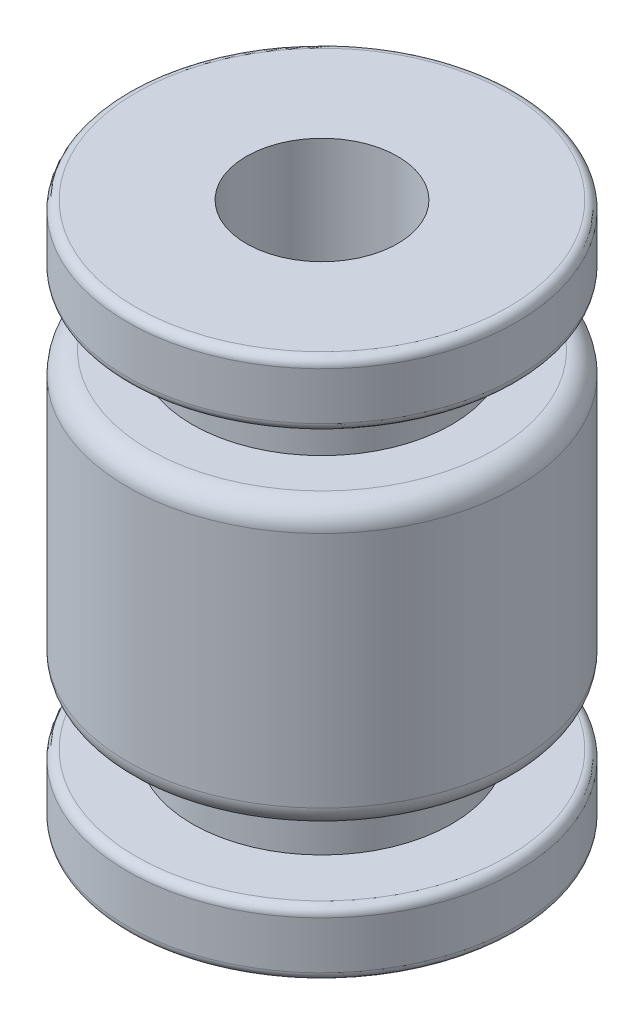
from build123d import *

# Parameters (mm, degrees)
FILLET1_R = 0.5
FILLET2_R = 0.2


with BuildPart() as part:
    # Sketch1 → Revolve1 (revolve)
    with BuildSketch(Plane.XY):
        Polygon((1.75, 6.25), (1.75, -6.25), (4.5, -6.25), (4.5, -4.75), (3, -4.75), (3, -3.25), (4.5, -3.25), (4.5, 3.25), (3, 3.25), (3, 4.75), (4.5, 4.75), (4.5, 6.25), align=None)
    revolve(axis=Axis((0, 6.25, 0), (0, -1, 0)))

    # Fillet1
    fillet1_edges = [part.edges().sort_by_distance(p)[0] for p in [
        (-4.5, -3.25, 0),
        (-4.5, 3.25, 0),
    ]]
    fillet(fillet1_edges, radius=FILLET1_R)

    # Fillet2
    fillet2_edges = [part.edges().sort_by_distance(p)[0] for p in [
        (-4.5, -6.25, 0),
        (-4.5, -4.75, 0),
        (-4.5, 4.75, 0),
        (-4.5, 6.25, 0),
    ]]
    fillet(fillet2_edges, radius=FILLET2_R)


solid = part.part
